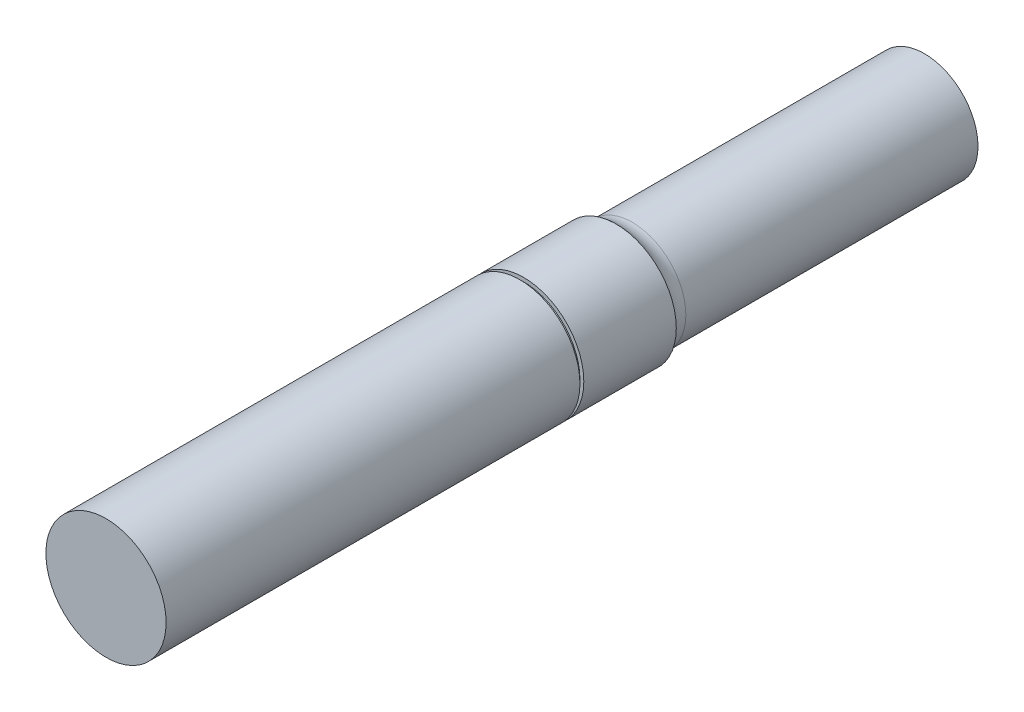
from build123d import *

# Parameters (mm, degrees)
REDONDEO1_R                      = 0.762
TALADRO_DE_MARGEN_PARA_101_D     = 1.4986
TALADRO_DE_MARGEN_PARA_101_DEPTH = 1.1176
TALADRO_DE_MARGEN_PARA_101_TIP   = 0.450224862
CHAFL_N1_SIZE                    = 0.8382
CHAFL_N1_SIZE2                   = 0.483934996


with BuildPart() as part:
    # Croquis1 → Revolución1 (revolve)
    with BuildSketch(Plane(origin=(0, 0, 0), x_dir=(0, 0, -1), z_dir=(1, 0, 0)), mode=Mode.PRIVATE) as revoluci_n1_sk:
        Polygon((-13.4874, 0), (-13.4874, 1.9812), (0.1524, 1.9812), (0.1524, 1.8542), (0.2794, 1.8542), (0.2794, 1.9812), (3.3274, 1.9812), (3.3274, 1.7653), (13.4874, 1.7653), (13.4874, 0), align=None)
    revolve(revoluci_n1_sk.sketch.rotate(Axis((0, 0, 127), (0, 0, -1)), 90), axis=Axis((0, 0, 127), (0, 0, -1)))

    # Redondeo1
    # the kernel refuses this fillet: 0.762 mm, written as the material it adds along each edge
    with BuildSketch(Plane(origin=(0, 0, -3.3274), x_dir=(1, 0, 0), z_dir=(0, 1, 0))) as redondeo1_piece_1:
        with BuildLine():
            CenterArc((2.5273, 0.531430889), REDONDEO1_R, 180, 44.220044428)
            Line((1.7653, 0.531430889), (1.75006, 0.531430889))
            Line((1.75006, 0.531430889), (1.75006, 0))
            Line((1.75006, 0), (1.7653, -0.01524))
            ThreePointArc((1.7653, -0.01524), (1.87325, -0.01524), (1.970278, -0.010628618))
            Line((1.970278, -0.010628618), (1.9812, 0))
        make_face()
    revolve(axis=Axis((0, 0, -3.3274), (0, 0, -1)))

    # Taladro de margen para #101
    with Locations(Plane(origin=(0, 0, -13.4874), x_dir=(-1, 0, 0), z_dir=(0, 0, -1))):
        with Locations((0, 0)):
            Hole(TALADRO_DE_MARGEN_PARA_101_D / 2, depth=TALADRO_DE_MARGEN_PARA_101_DEPTH)
            with Locations((0, 0, -(TALADRO_DE_MARGEN_PARA_101_DEPTH + TALADRO_DE_MARGEN_PARA_101_TIP / 2))):  # 118° drill point
                Cone(0, TALADRO_DE_MARGEN_PARA_101_D / 2, TALADRO_DE_MARGEN_PARA_101_TIP, mode=Mode.SUBTRACT)

    # Chaflán1
    chafl_n1_edges = [part.edges().sort_by_distance(p)[0] for p in [
        (-0.7493, 0, -13.4874),
    ]]
    chafl_n1_side = [part.faces().sort_by_distance(p)[0] for p in [
        (-1.715369776, 0, -13.4874),
    ]]
    chamfer(chafl_n1_edges, length=CHAFL_N1_SIZE, length2=CHAFL_N1_SIZE2, reference=chafl_n1_side[0])


solid = part.part
